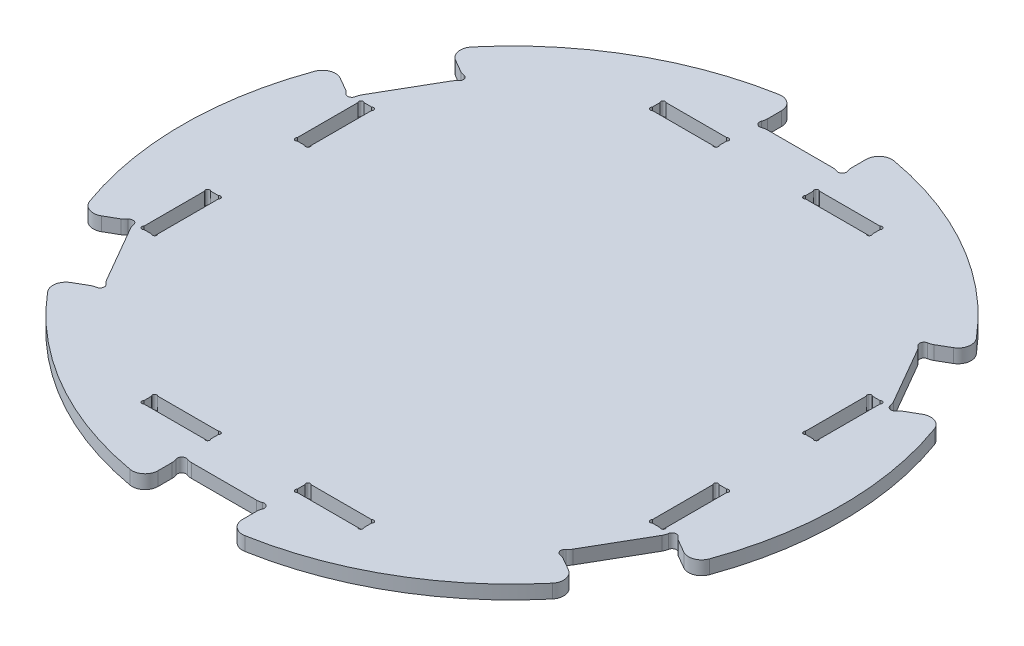
from build123d import *

# Parameters (mm, degrees)
SKETCH1_R                   = 76.1
BOSS_EXTRUDE1_DEPTH         = 3.175
SKETCH2_W                   = 19.5
SKETCH2_H                   = 9.6
BRACKETHOLE_DEPTH           = 108.66847554
SKETCH3_R                   = 1
DOGBONE_DEPTH               = 108.66847554
FILLET1_R                   = 3
CIRPATTERN1_COUNT           = 6
CIRPATTERN1_COPY_1_SKETCH_R = 1
CIRPATTERN1_COPY_1_DEPTH    = 108.66847554
CIRPATTERN1_COPY_2_SKETCH_R = 1
CIRPATTERN1_COPY_2_DEPTH    = 108.66847554
CIRPATTERN1_COPY_3_SKETCH_R = 1
CIRPATTERN1_COPY_3_DEPTH    = 108.66847554
CIRPATTERN1_COPY_4_SKETCH_R = 1
CIRPATTERN1_COPY_4_DEPTH    = 108.66847554
CIRPATTERN1_COPY_5_SKETCH_R = 1
CIRPATTERN1_COPY_5_DEPTH    = 108.66847554
FILLET1_OF_CIRPATTERN1_R    = 3
SKETCH5_W                   = 15.4
SKETCH5_H                   = 3.175
CUT_EXTRUDE3_DEPTH          = 107.879441834
SKETCH6_R                   = 0.5
CUT_EXTRUDE4_DEPTH          = 107.879441834
SKETCH_PATTERN1_DEPTH       = 3.175
CIRPATTERN2_COUNT           = 4
CIRPATTERN2_COPY_1_SKETCH_R = 0.5
CIRPATTERN2_COPY_1_DEPTH    = 107.879441834
CIRPATTERN2_COPY_2_SKETCH_R = 0.5
CIRPATTERN2_COPY_2_DEPTH    = 107.879441834
CIRPATTERN2_COPY_3_SKETCH_R = 0.5
CIRPATTERN2_COPY_3_DEPTH    = 107.879441834
CIRPATTERN2_COPY_4_DEPTH    = 3.175
CIRPATTERN2_COPY_5_DEPTH    = 3.175
CIRPATTERN2_COPY_6_DEPTH    = 3.175


# Read off the part's stored shape, not the designer's step: Sketch-Pattern1
with BuildPart() as part:
    # Sketch1 → Boss-Extrude1 (new body)
    with BuildSketch(Plane(origin=(0, 0, 0), x_dir=(1, 0, 0), z_dir=(0, 1, 0))):
        with Locations(Location((0, 0, 0), (0, 0, 270))):
            Circle(SKETCH1_R)
    extrude(amount=BOSS_EXTRUDE1_DEPTH)

    # Sketch2 → bracketHole (cut, symmetric)
    with BuildSketch(Plane(origin=(0, 3.175, 0), x_dir=(1, 0, 0), z_dir=(0, 1, 0))):
        with Locations((0, 71.3)):
            Rectangle(SKETCH2_W, SKETCH2_H)
    brackethole = extrude(amount=BRACKETHOLE_DEPTH, both=True, mode=Mode.SUBTRACT)

    # Sketch3 → dogbone (cut, symmetric)
    with BuildSketch(Plane(origin=(0, 3.175, 0), x_dir=(1, 0, 0), z_dir=(0, 1, 0))):
        with Locations((-9.042893219, 67.207106781)):
            Circle(SKETCH3_R)
    dogbone = extrude(amount=DOGBONE_DEPTH, both=True, mode=Mode.SUBTRACT)

    # Mirror1: dogbone across plane
    add(dogbone.mirror(Plane(origin=(0, 0, 0), x_dir=(0, 0, 1), z_dir=(1, 0, 0))), mode=Mode.SUBTRACT)

    # Fillet1
    fillet1_edges = [part.edges().sort_by_distance(p)[0] for p in [
        (9.75, 1.5875, -75.472826236),
        (-9.75, 1.5875, -75.472826236),
        (-8.335786438, 1.5875, -66.5),
        (-9.75, 1.5875, -67.914213562),
        (8.335786438, 1.5875, -66.5),
        (9.75, 1.5875, -67.914213562),
    ]]
    fillet(fillet1_edges, radius=FILLET1_R)

    # CirPattern1: bracketHole, dogbone ×6 about axis
    cirpattern1_axis = Axis((0, 0, 0), (0, 1, 0))
    add([brackethole.rotate(cirpattern1_axis, i * 360 / CIRPATTERN1_COUNT) for i in range(1, CIRPATTERN1_COUNT)], mode=Mode.SUBTRACT)
    add([dogbone.rotate(cirpattern1_axis, i * 360 / CIRPATTERN1_COUNT) for i in range(1, CIRPATTERN1_COUNT)], mode=Mode.SUBTRACT)

    # CirPattern1 copy 1 sketch → CirPattern1 copy 1 (cut, symmetric)
    with BuildSketch(Plane(origin=(0, 3.175, 0), x_dir=(-0.5000000000000001, 0, 0.8660254037844386), z_dir=(0, 1, 0))):
        with Locations((-9.042893219, -67.207106781)):
            Circle(CIRPATTERN1_COPY_1_SKETCH_R)
    extrude(amount=CIRPATTERN1_COPY_1_DEPTH, both=True, mode=Mode.SUBTRACT)

    # CirPattern1 copy 2 sketch → CirPattern1 copy 2 (cut, symmetric)
    with BuildSketch(Plane(origin=(0, 3.175, 0), x_dir=(0.4999999999999998, 0, 0.8660254037844387), z_dir=(0, 1, 0))):
        with Locations((-9.042893219, -67.207106781)):
            Circle(CIRPATTERN1_COPY_2_SKETCH_R)
    extrude(amount=CIRPATTERN1_COPY_2_DEPTH, both=True, mode=Mode.SUBTRACT)

    # CirPattern1 copy 3 sketch → CirPattern1 copy 3 (cut, symmetric)
    with BuildSketch(Plane(origin=(0, 3.175, 0), x_dir=(1, 0, 0), z_dir=(0, 1, 0))):
        with Locations((-9.042893219, -67.207106781)):
            Circle(CIRPATTERN1_COPY_3_SKETCH_R)
    extrude(amount=CIRPATTERN1_COPY_3_DEPTH, both=True, mode=Mode.SUBTRACT)

    # CirPattern1 copy 4 sketch → CirPattern1 copy 4 (cut, symmetric)
    with BuildSketch(Plane(origin=(0, 3.175, 0), x_dir=(0.5000000000000004, 0, -0.8660254037844384), z_dir=(0, 1, 0))):
        with Locations((-9.042893219, -67.207106781)):
            Circle(CIRPATTERN1_COPY_4_SKETCH_R)
    extrude(amount=CIRPATTERN1_COPY_4_DEPTH, both=True, mode=Mode.SUBTRACT)

    # CirPattern1 copy 5 sketch → CirPattern1 copy 5 (cut, symmetric)
    with BuildSketch(Plane(origin=(0, 3.175, 0), x_dir=(-0.5000000000000001, 0, -0.8660254037844386), z_dir=(0, 1, 0))):
        with Locations((-9.042893219, -67.207106781)):
            Circle(CIRPATTERN1_COPY_5_SKETCH_R)
    extrude(amount=CIRPATTERN1_COPY_5_DEPTH, both=True, mode=Mode.SUBTRACT)

    # Fillet1 of CirPattern1
    fillet1_of_cirpattern1_edges = [part.edges().sort_by_distance(p)[0] for p in [
        (-60.486384816, 1.5875, -46.180160805),
        (-70.236384816, 1.5875, -29.292665431),
        (-61.75858257, 1.5875, -26.030997184),
        (-63.690434223, 1.5875, -25.513359094),
        (-53.422796133, 1.5875, -40.469002816),
        (-53.940434223, 1.5875, -42.400854468),
        (-70.236384816, 1.5875, 29.292665431),
        (-60.486384816, 1.5875, 46.180160805),
        (-53.422796133, 1.5875, 40.469002816),
        (-53.940434223, 1.5875, 42.400854468),
        (-61.75858257, 1.5875, 26.030997184),
        (-63.690434223, 1.5875, 25.513359094),
        (-9.75, 1.5875, 75.472826236),
        (9.75, 1.5875, 75.472826236),
        (8.335786438, 1.5875, 66.5),
        (9.75, 1.5875, 67.914213562),
        (-8.335786438, 1.5875, 66.5),
        (-9.75, 1.5875, 67.914213562),
        (60.486384816, 1.5875, 46.180160805),
        (70.236384816, 1.5875, 29.292665431),
        (61.75858257, 1.5875, 26.030997184),
        (63.690434223, 1.5875, 25.513359094),
        (53.422796133, 1.5875, 40.469002816),
        (53.940434223, 1.5875, 42.400854468),
        (70.236384816, 1.5875, -29.292665431),
        (60.486384816, 1.5875, -46.180160805),
        (53.422796133, 1.5875, -40.469002816),
        (53.940434223, 1.5875, -42.400854468),
        (61.75858257, 1.5875, -26.030997184),
        (63.690434223, 1.5875, -25.513359094),
    ]]
    fillet(fillet1_of_cirpattern1_edges, radius=FILLET1_OF_CIRPATTERN1_R)

    # Sketch5 → Cut-Extrude3 (cut, symmetric)
    with BuildSketch(Plane(origin=(0, 3.175, 0), x_dir=(1, 0, 0), z_dir=(0, 1, 0))):
        with Locations((17.7, 58.6875)):
            Rectangle(SKETCH5_W, SKETCH5_H)
        with Locations((-17.7, 58.6875)):
            Rectangle(SKETCH5_W, SKETCH5_H)
    cut_extrude3 = extrude(amount=CUT_EXTRUDE3_DEPTH, both=True, mode=Mode.SUBTRACT)

    # Sketch6 → Cut-Extrude4 (cut, symmetric)
    with BuildSketch(Plane(origin=(0, 3.175, 0), x_dir=(1, 0, 0), z_dir=(0, 1, 0))):
        with Locations((-25.046446609, 59.921446609)):
            Circle(SKETCH6_R)
        with Locations((-25.046446609, 57.453553391)):
            Circle(SKETCH6_R)
    cut_extrude4 = extrude(amount=CUT_EXTRUDE4_DEPTH, both=True, mode=Mode.SUBTRACT)

    # Sketch-Pattern1 outline → Sketch-Pattern1 (cut)
    with BuildSketch(Plane(origin=(0, 0, 0), x_dir=(1, 0, 0), z_dir=(0, 1, 0))):
        with BuildLine():
            Line((10, 60.275), (10.707106781, 60.275))
            ThreePointArc((10.707106781, 60.275), (10.353553391, 60.421446609), (10, 60.275))
        make_face()
        with BuildLine():
            Line((10.707106781, 57.1), (10, 57.1))
            ThreePointArc((10, 57.1), (10.353553391, 56.953553391), (10.707106781, 57.1))
        make_face()
        with BuildLine():
            Line((10, 57.1), (10, 57.807106781))
            ThreePointArc((10, 57.807106781), (9.853553391, 57.453553391), (10, 57.1))
        make_face()
        with BuildLine():
            Line((10, 59.567893219), (10, 60.275))
            ThreePointArc((10, 60.275), (9.853553391, 59.921446609), (10, 59.567893219))
        make_face()
    sketch_pattern1 = extrude(amount=SKETCH_PATTERN1_DEPTH, mode=Mode.SUBTRACT)

    # Mirror2: Cut-Extrude4, Sketch-Pattern1 across plane
    add(cut_extrude4.mirror(Plane(origin=(0, 0, 0), x_dir=(0, 0, 1), z_dir=(1, 0, 0))), mode=Mode.SUBTRACT)
    add(sketch_pattern1.mirror(Plane(origin=(0, 0, 0), x_dir=(0, 0, 1), z_dir=(1, 0, 0))), mode=Mode.SUBTRACT)

    # CirPattern2: Cut-Extrude3, Cut-Extrude4, Sketch-Pattern1 ×4 about axis
    cirpattern2_axis = Axis((0, 0, 0), (0, 1, 0))
    add([cut_extrude3.rotate(cirpattern2_axis, i * 360 / CIRPATTERN2_COUNT) for i in range(1, CIRPATTERN2_COUNT)], mode=Mode.SUBTRACT)
    add([cut_extrude4.rotate(cirpattern2_axis, i * 360 / CIRPATTERN2_COUNT) for i in range(1, CIRPATTERN2_COUNT)], mode=Mode.SUBTRACT)
    add([sketch_pattern1.rotate(cirpattern2_axis, i * 360 / CIRPATTERN2_COUNT) for i in range(1, CIRPATTERN2_COUNT)], mode=Mode.SUBTRACT)

    # CirPattern2 copy 1 sketch → CirPattern2 copy 1 (cut, symmetric)
    with BuildSketch(Plane.ZX.offset(3.175)):
        with Locations((-25.046446609, -59.921446609)):
            Circle(CIRPATTERN2_COPY_1_SKETCH_R)
        with Locations((-25.046446609, -57.453553391)):
            Circle(CIRPATTERN2_COPY_1_SKETCH_R)
    extrude(amount=CIRPATTERN2_COPY_1_DEPTH, both=True, mode=Mode.SUBTRACT)

    # CirPattern2 copy 2 sketch → CirPattern2 copy 2 (cut, symmetric)
    with BuildSketch(Plane(origin=(0, 3.175, 0), x_dir=(1, 0, 0), z_dir=(0, 1, 0))):
        with Locations((-25.046446609, -59.921446609)):
            Circle(CIRPATTERN2_COPY_2_SKETCH_R)
        with Locations((-25.046446609, -57.453553391)):
            Circle(CIRPATTERN2_COPY_2_SKETCH_R)
    extrude(amount=CIRPATTERN2_COPY_2_DEPTH, both=True, mode=Mode.SUBTRACT)

    # CirPattern2 copy 3 sketch → CirPattern2 copy 3 (cut, symmetric)
    with BuildSketch(Plane(origin=(0, 3.175, 0), x_dir=(0, 0, -1), z_dir=(0, 1, 0))):
        with Locations((-25.046446609, -59.921446609)):
            Circle(CIRPATTERN2_COPY_3_SKETCH_R)
        with Locations((-25.046446609, -57.453553391)):
            Circle(CIRPATTERN2_COPY_3_SKETCH_R)
    extrude(amount=CIRPATTERN2_COPY_3_DEPTH, both=True, mode=Mode.SUBTRACT)

    # CirPattern2 copy 4 sketch → CirPattern2 copy 4 (cut)
    with BuildSketch(Plane.ZX):
        with BuildLine():
            Line((10, -60.275), (10.707106781, -60.275))
            ThreePointArc((10.707106781, -60.275), (10.353553391, -60.421446609), (10, -60.275))
        make_face()
        with BuildLine():
            Line((10.707106781, -57.1), (10, -57.1))
            ThreePointArc((10, -57.1), (10.353553391, -56.953553391), (10.707106781, -57.1))
        make_face()
        with BuildLine():
            Line((10, -57.1), (10, -57.807106781))
            ThreePointArc((10, -57.807106781), (9.853553391, -57.453553391), (10, -57.1))
        make_face()
        with BuildLine():
            Line((10, -59.567893219), (10, -60.275))
            ThreePointArc((10, -60.275), (9.853553391, -59.921446609), (10, -59.567893219))
        make_face()
    extrude(amount=CIRPATTERN2_COPY_4_DEPTH, mode=Mode.SUBTRACT)

    # CirPattern2 copy 5 sketch → CirPattern2 copy 5 (cut)
    with BuildSketch(Plane(origin=(0, 0, 0), x_dir=(1, 0, 0), z_dir=(0, 1, 0))):
        with BuildLine():
            Line((10, -60.275), (10.707106781, -60.275))
            ThreePointArc((10.707106781, -60.275), (10.353553391, -60.421446609), (10, -60.275))
        make_face()
        with BuildLine():
            Line((10.707106781, -57.1), (10, -57.1))
            ThreePointArc((10, -57.1), (10.353553391, -56.953553391), (10.707106781, -57.1))
        make_face()
        with BuildLine():
            Line((10, -57.1), (10, -57.807106781))
            ThreePointArc((10, -57.807106781), (9.853553391, -57.453553391), (10, -57.1))
        make_face()
        with BuildLine():
            Line((10, -59.567893219), (10, -60.275))
            ThreePointArc((10, -60.275), (9.853553391, -59.921446609), (10, -59.567893219))
        make_face()
    extrude(amount=CIRPATTERN2_COPY_5_DEPTH, mode=Mode.SUBTRACT)

    # CirPattern2 copy 6 sketch → CirPattern2 copy 6 (cut)
    with BuildSketch(Plane(origin=(0, 0, 0), x_dir=(0, 0, -1), z_dir=(0, 1, 0))):
        with BuildLine():
            Line((10, -60.275), (10.707106781, -60.275))
            ThreePointArc((10.707106781, -60.275), (10.353553391, -60.421446609), (10, -60.275))
        make_face()
        with BuildLine():
            Line((10.707106781, -57.1), (10, -57.1))
            ThreePointArc((10, -57.1), (10.353553391, -56.953553391), (10.707106781, -57.1))
        make_face()
        with BuildLine():
            Line((10, -57.1), (10, -57.807106781))
            ThreePointArc((10, -57.807106781), (9.853553391, -57.453553391), (10, -57.1))
        make_face()
        with BuildLine():
            Line((10, -59.567893219), (10, -60.275))
            ThreePointArc((10, -60.275), (9.853553391, -59.921446609), (10, -59.567893219))
        make_face()
    extrude(amount=CIRPATTERN2_COPY_6_DEPTH, mode=Mode.SUBTRACT)


solid = part.part
